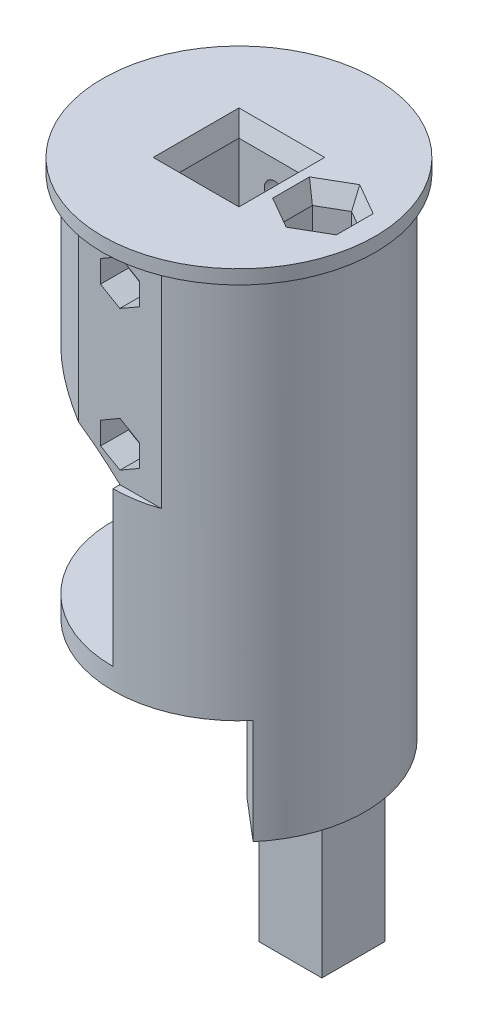
from build123d import *
from build123d.topology import SkipClean

# Parameters (mm, degrees)
SKETCH_1_R          = 18
EXTRUDE_1_DEPTH     = 55
SKETCH_2_R          = 19.5
EXTRUDE_2_DEPTH     = 2
SKETCH_3_W          = 10.25
SKETCH_3_H          = 10.25
CUT_EXTRUDE_1_DEPTH = 40
EXTRUDE_START       = 15
EXTRUDE_3_DEPTH     = 15
BOSS_EXTRUDE1_START = 20
SKETCH1_R           = 18
BOSS_EXTRUDE1_DEPTH = 20
BOSS_EXTRUDE2_START = 7
SKETCH3_R           = 18
BOSS_EXTRUDE2_DEPTH = 7
SKETCH4_W           = 10.2
SKETCH4_H           = 10.2
CUT_EXTRUDE2_DEPTH  = 27
CUT_EXTRUDE4_DEPTH  = 25
BOSS_EXTRUDE3_DEPTH = 3
SKETCH9_W           = 36
SKETCH9_H           = 22
CUT_EXTRUDE5_DEPTH  = 8
SKETCH10_R          = 3.7
SKETCH10_W          = 3
SKETCH10_H          = 2
CUT_EXTRUDE6_DEPTH  = 10
SKETCH11_R          = 2
CUT_EXTRUDE7_DEPTH  = 102
SKETCH15_R          = 18
CUT_EXTRUDE9_DEPTH  = 27
CUT_EXTRUDE11_DEPTH = 30
SKETCH18_R          = 1.5
CUT_EXTRUDE12_DEPTH = 71.437915926
SKETCH19_R          = 3
CUT_EXTRUDE13_DEPTH = 3
BOSS_EXTRUDE5_DEPTH = 22
CUT_EXTRUDE16_DEPTH = 4
CUT_EXTRUDE17_DEPTH = 30
CUT_EXTRUDE18_DEPTH = 71.437915926
FILLET2_R           = 5
SKETCH30_W          = 18.8
SKETCH30_H          = 10
CUT_EXTRUDE20_DEPTH = 3
CHAMFER1_SIZE       = 1
CHAMFER1_SIZE2      = 2.747477419
CHAMFER2_SIZE       = 1
CHAMFER2_SIZE2      = 2.747477419
BOSS_EXTRUDE7_START = 20
SKETCH37_W          = 9
SKETCH37_H          = 9
SKETCH37_R          = 2
BOSS_EXTRUDE7_DEPTH = 20
CUT_EXTRUDE22_DEPTH = 15
CUT_EXTRUDE23_REACH = 79.101
SKETCH40_W          = 4.363156696
SKETCH40_H          = 4.363156696
CUT_EXTRUDE24_DEPTH = 10
FILLET7_R           = 6
CHAMFER3_SIZE       = 3


with BuildPart() as part:
    # Эскиз1 → Бобышка-Вытянуть1 (new body)
    with BuildSketch(Plane(origin=(0, 0, 0), x_dir=(1, 0, 0), z_dir=(0, 1, 0))):
        with Locations(Location((0, 0, 0), (0, 0, 270))):
            Circle(SKETCH_1_R)
    extrude(amount=EXTRUDE_1_DEPTH)

    # Эскиз2 → Бобышка-Вытянуть2 (add)
    with BuildSketch(Plane(origin=(0, 55, 0), x_dir=(1, 0, 0), z_dir=(0, 1, 0))):
        with Locations(Location((0, 0, 0), (0, 0, 270))):
            Circle(SKETCH_2_R)
    extrude(amount=EXTRUDE_2_DEPTH)

    # Эскиз3 → Вырез-Вытянуть1 (cut)
    with BuildSketch(Plane(origin=(0, 57, 0), x_dir=(1, 0, 0), z_dir=(0, 1, 0))):
        Rectangle(SKETCH_3_W, SKETCH_3_H)
    extrude(amount=-CUT_EXTRUDE_1_DEPTH, mode=Mode.SUBTRACT)

    # Эскиз4 → Бобышка-Вытянуть3 (add)
    with SkipClean():  # the faces are left unmerged after this step: merging them gives an invalid solid
        with BuildSketch(Plane.XZ.offset(EXTRUDE_START)):
            with BuildLine():
                Line((5.142300877, -6.128355545), (11.570176974, -13.788799976))
                ThreePointArc((11.570176974, -13.788799976), (17.937391115, -1.5), (13.69961987, 11.675633406))
                Line((13.69961987, 11.675633406), (5.142300877, 4.38257561))
                Line((5.142300877, 4.38257561), (5.142300877, -6.128355545))
            make_face()
        extrude(amount=-EXTRUDE_3_DEPTH)

    # Sketch1 → Boss-Extrude1 (add)
    with BuildSketch(Plane.XZ.offset(15).offset(BOSS_EXTRUDE1_START)):
        with Locations(Location((0, 0, 0), (0, 0, 270))):
            Circle(SKETCH1_R)
    extrude(amount=-BOSS_EXTRUDE1_DEPTH)

    # Sketch3 → Boss-Extrude2 (add)
    with BuildSketch(Plane.XZ.offset(35).offset(BOSS_EXTRUDE2_START)):
        with Locations(Location((0, 0, 0), (0, 0, 270))):
            Circle(SKETCH3_R)
    extrude(amount=-BOSS_EXTRUDE2_DEPTH)

    # Sketch4 → Cut-Extrude2 (cut)
    with BuildSketch(Plane.XZ.offset(42)):
        Rectangle(SKETCH4_W, SKETCH4_H)
    extrude(amount=-CUT_EXTRUDE2_DEPTH, mode=Mode.SUBTRACT)

    # Sketch6 → Cut-Extrude4 (cut)
    with BuildSketch(Plane.XZ):
        with BuildLine():
            Line((0, 18), (0, -18))
            ThreePointArc((0, -18), (-18, 0), (0, 18))
        make_face()
    extrude(amount=-CUT_EXTRUDE4_DEPTH, mode=Mode.SUBTRACT)

    # Sketch8 → Boss-Extrude3 (add)
    with BuildSketch(Plane.XZ):
        with BuildLine():
            Line((0, -18), (0, 18))
            ThreePointArc((0, 18), (-18, 0), (0, -18))
        make_face()
    extrude(amount=-BOSS_EXTRUDE3_DEPTH)

    # Sketch9 → Cut-Extrude5 (cut)
    with BuildSketch(Plane.ZY):
        with Locations((0, 14)):
            Rectangle(SKETCH9_W, SKETCH9_H)
    extrude(amount=-CUT_EXTRUDE5_DEPTH, mode=Mode.SUBTRACT)

    # Sketch10 → Cut-Extrude6 (cut)
    with BuildSketch(Plane.XZ):
        with Locations(Location((0, 0, 0), (0, 0, 270))):
            Circle(SKETCH10_R)
        with Locations((0, 7.7)):
            Rectangle(SKETCH10_W, SKETCH10_H)
    extrude(amount=-CUT_EXTRUDE6_DEPTH, mode=Mode.SUBTRACT)

    # Sketch11 → Cut-Extrude7 (cut)
    with BuildSketch(Plane.XZ.offset(42)):
        with Locations(Location((12, 0, 0), (0, 0, 270))):
            Circle(SKETCH11_R)
    extrude(amount=-CUT_EXTRUDE7_DEPTH, mode=Mode.SUBTRACT)

    # Sketch15 → Cut-Extrude9 (cut)
    with BuildSketch(Plane.XZ.offset(42)):
        with Locations(Location((0, 0, 0), (0, 0, 310))):
            Circle(SKETCH15_R)
    extrude(amount=-CUT_EXTRUDE9_DEPTH, mode=Mode.SUBTRACT)

    # Sketch17 → Cut-Extrude11 (cut)
    with BuildSketch(Plane.XZ.offset(-25)):
        with BuildLine():
            Line((5.916079783, -17), (-5.916079783, -17))
            ThreePointArc((-5.916079783, -17), (0, -18), (5.916079783, -17))
        make_face()
        with BuildLine():
            Line((5.916079783, 17), (-5.916079783, 17))
            ThreePointArc((-5.916079783, 17), (0, 18), (5.916079783, 17))
        make_face()
    extrude(amount=-CUT_EXTRUDE11_DEPTH, mode=Mode.SUBTRACT)

    # Sketch18 → Cut-Extrude12 (cut, through all)
    with BuildSketch(Plane.XY.offset(-17)):
        with Locations(Location((0, 30, 0), (0, 0, 180))):
            Circle(SKETCH18_R)
        with Locations(Location((0, 50, 0), (0, 0, 180))):
            Circle(SKETCH18_R)
    extrude(amount=CUT_EXTRUDE12_DEPTH, mode=Mode.SUBTRACT)

    # Sketch19 → Cut-Extrude13 (cut)
    with BuildSketch(Plane.XY.offset(-17)):
        with Locations((0, 30)):
            Circle(SKETCH19_R)
        with Locations((0, 50)):
            Circle(SKETCH19_R)
    extrude(amount=CUT_EXTRUDE13_DEPTH, mode=Mode.SUBTRACT)

    # Sketch23 → Boss-Extrude5 (add)
    with BuildSketch(Plane(origin=(0, 3, 0), x_dir=(1, 0, 0), z_dir=(0, 1, 0))):
        with BuildLine():
            Line((0, -14.4), (8, -14.4))
            Line((8, -14.4), (8, -16.124515497))
            ThreePointArc((8, -16.124515497), (4.108449894, -17.524857759), (0, -18))
            Line((0, -18), (0, -14.4))
        make_face()
        with BuildLine():
            Line((0, 14.4), (8, 14.4))
            Line((8, 14.4), (8, 16.124515497))
            ThreePointArc((8, 16.124515497), (4.108449894, 17.524857759), (0, 18))
            Line((0, 18), (0, 14.4))
        make_face()
    extrude(amount=BOSS_EXTRUDE5_DEPTH)

    # Sketch25 → Cut-Extrude16 (cut)
    with BuildSketch(Plane.XY.offset(17)):
        Polygon((2.771281292, 28.4), (2.771281292, 31.6), (0, 33.2), (-2.771281292, 31.6), (-2.771281292, 28.4), (0, 26.8), align=None)
        Polygon((-2.782126929, 48.418933983), (-0.021820128, 46.800074394), (2.760306801, 48.381140412), (2.782126929, 51.581066017), (0.021820128, 53.199925606), (-2.760306801, 51.618859588), align=None)
    extrude(amount=-CUT_EXTRUDE16_DEPTH, mode=Mode.SUBTRACT)

    # Sketch26 → Cut-Extrude17 (cut)
    with BuildSketch(Plane(origin=(0, 57, 0), x_dir=(1, 0, 0), z_dir=(0, 1, 0))):
        Polygon((8.449295844, -2.05), (12, -4.1), (15.550704156, -2.05), (15.550704156, 2.05), (12, 4.1), (8.449295844, 2.05), align=None)
    extrude(amount=-CUT_EXTRUDE17_DEPTH, mode=Mode.SUBTRACT)

    # Sketch27 → Cut-Extrude18 (cut, through all)
    with BuildSketch(Plane.XY.offset(17)):
        with BuildLine():
            Line((-20, 36.547005384), (-20, 25))
            Line((-20, 25), (0, 25))
            ThreePointArc((0, 25), (-9.324199199, 31.944024015), (-20, 36.547005384))
        make_face()
    extrude(amount=-CUT_EXTRUDE18_DEPTH, mode=Mode.SUBTRACT)

    # Fillet2
    fillet2_edges = [part.edges().sort_by_distance(p)[0] for p in [
        (8, 14, -14.4),
        (8, 14, 14.4),
    ]]
    fillet(fillet2_edges, radius=FILLET2_R)

    # Sketch30 → Cut-Extrude20 (cut)
    with BuildSketch(Plane.ZY.offset(-8)):
        with Locations((0, 8)):
            Rectangle(SKETCH30_W, SKETCH30_H)
    extrude(amount=-CUT_EXTRUDE20_DEPTH, mode=Mode.SUBTRACT)

    # Chamfer1
    chamfer1_edges = [part.edges().sort_by_distance(p)[0] for p in [
        (5.125, 57, 0),
        (0, 57, -5.125),
        (-5.125, 57, 0),
        (0, 57, 5.125),
    ]]
    chamfer1_side = [part.faces().sort_by_distance(p)[0] for p in [
        (0, 57, -18.948456711),
    ]]
    chamfer(chamfer1_edges, length=CHAMFER1_SIZE, length2=CHAMFER1_SIZE2, reference=chamfer1_side[0])

    # Chamfer2
    chamfer2_edges = [part.edges().sort_by_distance(p)[0] for p in [
        (8.449295844, 57, 0),
        (10.224647922, 57, 3.075),
        (13.775352078, 57, 3.075),
        (15.550704156, 57, 0),
        (13.775352078, 57, -3.075),
        (10.224647922, 57, -3.075),
    ]]
    chamfer2_side = [part.faces().sort_by_distance(p)[0] for p in [
        (6.676543289, 57, 0),
    ]]
    chamfer(chamfer2_edges, length=CHAMFER2_SIZE, length2=CHAMFER2_SIZE2, reference=chamfer2_side[0])

    # Sketch37 → Boss-Extrude7 (add)
    with BuildSketch(Plane.XZ.offset(15).offset(BOSS_EXTRUDE7_START)):
        with Locations((10.978822628, -0.872889968)):
            Rectangle(SKETCH37_W, SKETCH37_H)
        with Locations(Location((12, 0, 0), (0, 0, 270))):
            Circle(SKETCH37_R, mode=Mode.SUBTRACT)
    extrude(amount=-BOSS_EXTRUDE7_DEPTH)

    # Sketch38 → Cut-Extrude22 (cut)
    with BuildSketch(Plane.XZ.offset(15)):
        with BuildLine():
            Line((5.142300877, -6.128355545), (5.142300877, 4.38257561))
            ThreePointArc((5.142300877, 4.38257561), (5.978822628, -0.872889968), (5.142300877, -6.128355545))
        make_face()
    extrude(amount=-CUT_EXTRUDE22_DEPTH, mode=Mode.SUBTRACT)

    # Cut-Extrude23: up to this face of the body (flat: up to its plane)
    cut_extrude23_end = Plane(part.part.faces().sort_by_distance((9.450359937, 13, 0))[0])
    # Sketch39 → Cut-Extrude23 (cut, up to the picked face)
    with BuildSketch(Plane.XZ.offset(15), mode=Mode.PRIVATE) as cut_extrude23_sk1:
        with BuildLine():
            Line((7.420733648, -7.372889968), (15.420733648, -7.372889968))
            ThreePointArc((15.420733648, -7.372889968), (13.728515389, -10.030415688), (11.598853111, -12.352178848))
            Line((11.598853111, -12.352178848), (7.420733648, -7.372889968))
        make_face()
    cut_extrude23_tool1 = split(extrude(cut_extrude23_sk1.sketch, amount=-CUT_EXTRUDE23_REACH, mode=Mode.PRIVATE), bisect_by=cut_extrude23_end, keep=Keep.BOTH, mode=Mode.PRIVATE)
    add(cut_extrude23_tool1.solids().sort_by(Axis((11.596211, -15, -9.081847), (0, 1, 0)))[0], mode=Mode.SUBTRACT)

    # Sketch40 → Cut-Extrude24 (cut)
    with BuildSketch(Plane(origin=(0, 3, 0), x_dir=(1, 0, 0), z_dir=(0, 1, 0))):
        with Locations((9.602311996, 9.554468316)):
            Rectangle(SKETCH40_W, SKETCH40_H)
    extrude(amount=CUT_EXTRUDE24_DEPTH, mode=Mode.SUBTRACT)

    # Fillet7
    fillet7_edges = [part.edges().sort_by_distance(p)[0] for p in [
        (5.142300877, -7.5, 4.38257561),
        (5.142300877, -7.5, -6.128355545),
    ]]
    fillet(fillet7_edges, radius=FILLET7_R)

    # Chamfer3
    # the kernel refuses this chamfer: 3 mm, written as the material it adds along each edge
    with BuildSketch(Plane(origin=(0, 25, 14.4), x_dir=(0, -0.9996219169112968, 0.02749587661058619), z_dir=(1, 0, 0))) as chamfer3_piece_1_section:
        Polygon((CHAMFER3_SIZE * 0.999621916911, CHAMFER3_SIZE * 0.0274958766106), (-CHAMFER3_SIZE * 0.0274958766106, CHAMFER3_SIZE * 0.999621916911), (0, 0), align=None)
    chamfer3_piece_1 = extrude(amount=3, mode=Mode.PRIVATE)
    chamfer3_piece_1 = chamfer3_piece_1 & Plane(origin=(-34.324199199, -11.357246174, 13.709552738), x_dir=(0.6864839839775441, 0.727144923479714, 0), z_dir=(0, 0, 1)) * Cylinder(50, 18, mode=Mode.PRIVATE)
    add(chamfer3_piece_1)
    with BuildSketch(Plane(origin=(0, 25, 14.4), x_dir=(0, -0.9996219169112968, 0.02749587661058619), z_dir=(1, 0, 0))) as chamfer3_piece_2_section:
        Polygon((CHAMFER3_SIZE * 0.999621916911, CHAMFER3_SIZE * 0.0274958766106), (-CHAMFER3_SIZE * 0.0274958766106, CHAMFER3_SIZE * 0.999621916911), (0, 0), align=None)
    chamfer3_piece_2 = extrude(amount=3, mode=Mode.PRIVATE)
    chamfer3_piece_2 = chamfer3_piece_2 - Plane(origin=(-34.324199199, -11.357246174, 13.260106339), x_dir=(0.6864839839775441, 0.727144923479714, 0), z_dir=(0, 0, 1)) * Cylinder(50, 18, mode=Mode.PRIVATE)
    add(chamfer3_piece_2)
    with BuildSketch(Plane(origin=(0, 25, -14.4), x_dir=(0, -0.9996219169112968, -0.02749587661058619), z_dir=(1, 0, 0))) as chamfer3_piece_3_section:
        Polygon((CHAMFER3_SIZE * 0.999621916911, -CHAMFER3_SIZE * 0.0274958766106), (-CHAMFER3_SIZE * 0.0274958766106, -CHAMFER3_SIZE * 0.999621916911), (0, 0), align=None)
    chamfer3_piece_3 = extrude(amount=3, mode=Mode.PRIVATE)
    chamfer3_piece_3 = chamfer3_piece_3 & Plane(origin=(-34.324199199, -11.357246174, -13.709552738), x_dir=(0.6864839839775441, 0.727144923479714, 0), z_dir=(0, 0, 1)) * Cylinder(50, 18, mode=Mode.PRIVATE)
    add(chamfer3_piece_3)
    with BuildSketch(Plane(origin=(0, 25, -14.4), x_dir=(0, -0.9996219169112968, -0.02749587661058619), z_dir=(1, 0, 0))) as chamfer3_piece_4_section:
        Polygon((CHAMFER3_SIZE * 0.999621916911, -CHAMFER3_SIZE * 0.0274958766106), (-CHAMFER3_SIZE * 0.0274958766106, -CHAMFER3_SIZE * 0.999621916911), (0, 0), align=None)
    chamfer3_piece_4 = extrude(amount=3, mode=Mode.PRIVATE)
    chamfer3_piece_4 = chamfer3_piece_4 - Plane(origin=(-34.324199199, -11.357246174, -13.260106339), x_dir=(0.6864839839775441, 0.727144923479714, 0), z_dir=(0, 0, 1)) * Cylinder(50, 18, mode=Mode.PRIVATE)
    add(chamfer3_piece_4)
    with BuildSketch(Plane(origin=(3, 25, 9.4), x_dir=(0, 0, 1), z_dir=(-1, 0, 0))) as chamfer3_piece_5:
        Polygon((5, -CHAMFER3_SIZE), (5 - CHAMFER3_SIZE, 0), (5, 0), align=None)
    revolve(axis=Axis((3, 25, 9.4), (0, 1, 0)), revolution_arc=90)
    with BuildSketch(Plane(origin=(3, 25, -9.4), x_dir=(1, 0, 0), z_dir=(0, 0, 1))) as chamfer3_piece_6:
        Polygon((5, -CHAMFER3_SIZE), (5 - CHAMFER3_SIZE, 0), (5, 0), align=None)
    revolve(axis=Axis((3, 25, -9.4), (0, 1, 0)), revolution_arc=90)
    with BuildSketch(Plane(origin=(8, 25, 9.4), x_dir=(-0.9996219169112968, 0.027495876610586775, -6.983036009170595e-15), z_dir=(0, 0, -1))) as chamfer3_piece_7_section:
        Polygon((CHAMFER3_SIZE * 0.999621916911, -CHAMFER3_SIZE * 0.0274958766106), (-CHAMFER3_SIZE * 0.0274958766106, -CHAMFER3_SIZE * 0.999621916911), (0, 0), align=None)
    chamfer3_piece_7 = extrude(amount=18.8, mode=Mode.PRIVATE)
    chamfer3_piece_7 = split(chamfer3_piece_7, bisect_by=Plane(origin=(5.125, 25.046535353, 7.2625), z_dir=(-1, 0, 0)), keep=Keep.TOP, mode=Mode.PRIVATE)
    chamfer3_piece_7 = split(chamfer3_piece_7, bisect_by=Plane(origin=(5.041671012, 25.046535353, 5.125), z_dir=(0, 0, 1)), keep=Keep.TOP, mode=Mode.PRIVATE)
    add(chamfer3_piece_7)
    with BuildSketch(Plane(origin=(8, 25, 9.4), x_dir=(-0.9996219169112968, 0.027495876610586775, -6.983036009170595e-15), z_dir=(0, 0, -1))) as chamfer3_piece_8_section:
        Polygon((CHAMFER3_SIZE * 0.999621916911, -CHAMFER3_SIZE * 0.0274958766106), (-CHAMFER3_SIZE * 0.0274958766106, -CHAMFER3_SIZE * 0.999621916911), (0, 0), align=None)
    chamfer3_piece_8 = extrude(amount=18.8, mode=Mode.PRIVATE)
    chamfer3_piece_8 = split(chamfer3_piece_8, bisect_by=Plane(origin=(5.125, 24.003702171, 7.2625), z_dir=(1, 0, 0)), keep=Keep.TOP, mode=Mode.PRIVATE)
    chamfer3_piece_8 = split(chamfer3_piece_8, bisect_by=Plane(origin=(7.023766044, 24.003702171, 5.125), z_dir=(0, 0, 1)), keep=Keep.TOP, mode=Mode.PRIVATE)
    add(chamfer3_piece_8)
    with BuildSketch(Plane(origin=(8, 25, 9.4), x_dir=(-0.9996219169112968, 0.027495876610586775, -6.983036009170595e-15), z_dir=(0, 0, -1))) as chamfer3_piece_9_section:
        Polygon((CHAMFER3_SIZE * 0.999621916911, -CHAMFER3_SIZE * 0.0274958766106), (-CHAMFER3_SIZE * 0.0274958766106, -CHAMFER3_SIZE * 0.999621916911), (0, 0), align=None)
    chamfer3_piece_9 = extrude(amount=18.8, mode=Mode.PRIVATE)
    chamfer3_piece_9 = split(chamfer3_piece_9, bisect_by=Plane(origin=(7.023766044, 24.003702171, -5.125), z_dir=(0, 0, 1)), keep=Keep.TOP, mode=Mode.PRIVATE)
    chamfer3_piece_9 = split(chamfer3_piece_9, bisect_by=Plane(origin=(5.125, 24.003702171, 0), z_dir=(1, 0, 0)), keep=Keep.TOP, mode=Mode.PRIVATE)
    chamfer3_piece_9 = split(chamfer3_piece_9, bisect_by=Plane(origin=(7.023766044, 24.003702171, 5.125), z_dir=(0, 0, -1)), keep=Keep.TOP, mode=Mode.PRIVATE)
    add(chamfer3_piece_9)
    with BuildSketch(Plane(origin=(8, 25, 9.4), x_dir=(-0.9996219169112968, 0.027495876610586775, -6.983036009170595e-15), z_dir=(0, 0, -1))) as chamfer3_piece_10_section:
        Polygon((CHAMFER3_SIZE * 0.999621916911, -CHAMFER3_SIZE * 0.0274958766106), (-CHAMFER3_SIZE * 0.0274958766106, -CHAMFER3_SIZE * 0.999621916911), (0, 0), align=None)
    chamfer3_piece_10 = extrude(amount=18.8, mode=Mode.PRIVATE)
    chamfer3_piece_10 = split(chamfer3_piece_10, bisect_by=Plane(origin=(5.041671012, 25.046535353, -5.125), z_dir=(0, 0, -1)), keep=Keep.TOP, mode=Mode.PRIVATE)
    chamfer3_piece_10 = split(chamfer3_piece_10, bisect_by=Plane(origin=(5.125, 25.046535353, -7.2625), z_dir=(-1, 0, 0)), keep=Keep.TOP, mode=Mode.PRIVATE)
    add(chamfer3_piece_10)
    with BuildSketch(Plane(origin=(8, 25, 9.4), x_dir=(-0.9996219169112968, 0.027495876610586775, -6.983036009170595e-15), z_dir=(0, 0, -1))) as chamfer3_piece_11_section:
        Polygon((CHAMFER3_SIZE * 0.999621916911, -CHAMFER3_SIZE * 0.0274958766106), (-CHAMFER3_SIZE * 0.0274958766106, -CHAMFER3_SIZE * 0.999621916911), (0, 0), align=None)
    chamfer3_piece_11 = extrude(amount=18.8, mode=Mode.PRIVATE)
    chamfer3_piece_11 = split(chamfer3_piece_11, bisect_by=Plane(origin=(7.023766044, 24.003702171, -5.125), z_dir=(0, 0, -1)), keep=Keep.TOP, mode=Mode.PRIVATE)
    chamfer3_piece_11 = split(chamfer3_piece_11, bisect_by=Plane(origin=(5.125, 24.003702171, -7.2625), z_dir=(1, 0, 0)), keep=Keep.TOP, mode=Mode.PRIVATE)
    add(chamfer3_piece_11)


solid = part.part
